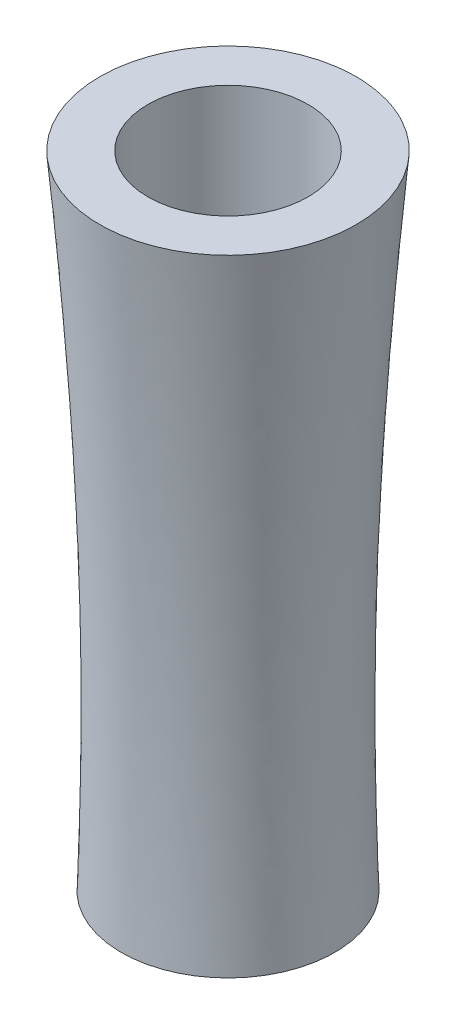
from build123d import *

# Parameters (mm, degrees)
CUT_EXTRUDE1_DEPTH      = 63.353829207
CUT_EXTRUDE1_DEPTH_BACK = 63.353829207
SKETCH3_R               = 7.5


with BuildPart() as part:
    # Loft1: read off the stored shape, not the designer's step
    # Loft1: loft between two sections, ruled curve by curve
    loft1_from = [
        Edge.make_bspline([(6.315963935, 0, 7.752973596), (21.821911126, 0, -4.878954273), (9.189983257, 0, -20.384901465), (-6.315963935, 0, -7.752973596), (-21.821911126, 0, 4.878954273), (-9.189983257, 0, 20.384901465), (6.315963935, 0, 7.752973596)], [0, 0, 0, 0, 0.5, 0.5, 0.5, 1, 1, 1, 1], 3, [1, 0.333333333, 0.333333333, 1, 0.333333333, 0.333333333, 1]),
    ]
    loft1_to = [
        Edge.make_bspline([(-2.04829248, 60, 11.823895209), (21.599497939, 60, 15.920480168), (25.696082898, 60, -7.72731025), (2.04829248, 60, -11.823895209), (-21.599497939, 60, -15.920480168), (-25.696082898, 60, 7.72731025), (-2.04829248, 60, 11.823895209)], [0, 0, 0, 0, 0.5, 0.5, 0.5, 1, 1, 1, 1], 3, [1, 0.333333333, 0.333333333, 1, 0.333333333, 0.333333333, 1]),
    ]
    loft1 = Solid(Shell([*[Face.make_surface_from_curves(loft1_from[k], loft1_to[k]) for k in range(1)], Face(Wire(loft1_from)), Face(Wire(loft1_to))]))
    add(loft1)

    # Sketch3 → Cut-Extrude1 (cut, two sides: drawn at the far end of the back side and taken through both)
    with BuildSketch(Plane(origin=(0, 60, 0), x_dir=(1, 0, 0), z_dir=(0, 1, 0)).offset(-CUT_EXTRUDE1_DEPTH_BACK)):
        with Locations(Location((0, 0, 0), (0, 0, 270))):
            Circle(SKETCH3_R)
    extrude(amount=CUT_EXTRUDE1_DEPTH + CUT_EXTRUDE1_DEPTH_BACK, mode=Mode.SUBTRACT)


solid = part.part
